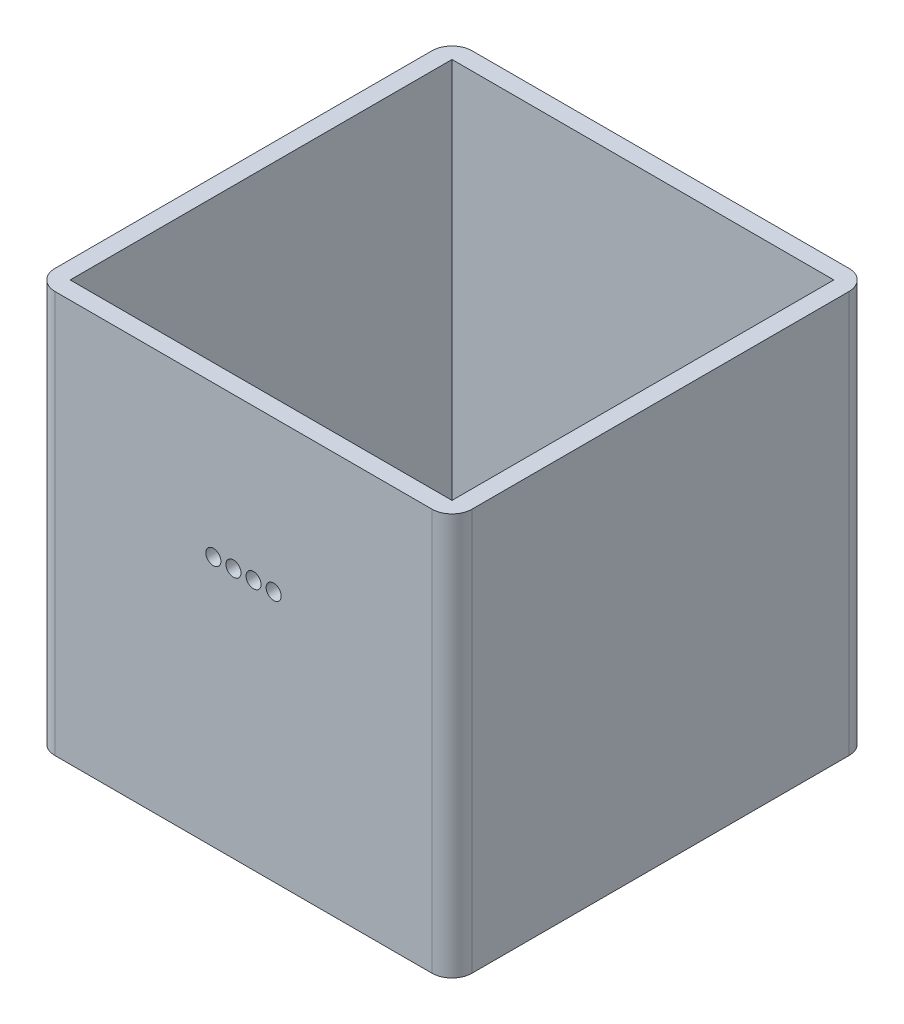
from build123d import *

# Parameters (mm, degrees)
BOSS_EXTRUDE2_DEPTH      = 40
BOSS_EXTRUDE2_DEPTH_BACK = 40
SKETCH4_W                = 83
SKETCH4_H                = 83
CUT_EXTRUDE1_DEPTH       = 50
CUT_EXTRUDE1_DEPTH_BACK  = 37.5
SKETCH5_W                = 76
SKETCH5_H                = 76
CUT_EXTRUDE2_DEPTH       = 74.5
CUT_EXTRUDE2_DEPTH_BACK  = 5
SKETCH6_R                = 1.5
SKETCH8_R                = 1
CUT_EXTRUDE3_DEPTH       = 70.5
SKETCH9_W                = 12
SKETCH9_H                = 7
CUT_EXTRUDE4_DEPTH       = 108.5
FILLET2_R                = 1
FILLET3_R                = 4


with BuildPart() as part:
    # Sketch4 → Boss-Extrude2 (new, two sides: drawn at the far end of the back side and taken through both)
    with BuildSketch(Plane(origin=(0, 0, 0), x_dir=(1, 0, 0), z_dir=(0, 1, 0)).offset(-BOSS_EXTRUDE2_DEPTH_BACK)):
        Rectangle(SKETCH4_W, SKETCH4_H)
    extrude(amount=BOSS_EXTRUDE2_DEPTH + BOSS_EXTRUDE2_DEPTH_BACK)

    # Sketch5 → Cut-Extrude1 (cut, two sides: drawn at the far end of the back side and taken through both)
    with BuildSketch(Plane(origin=(0, 0, 0), x_dir=(1, 0, 0), z_dir=(0, 1, 0)).offset(-CUT_EXTRUDE1_DEPTH_BACK)):
        Rectangle(SKETCH5_W, SKETCH5_H)
    extrude(amount=CUT_EXTRUDE1_DEPTH + CUT_EXTRUDE1_DEPTH_BACK, mode=Mode.SUBTRACT)

    # Sketch6 → Cut-Extrude2 (cut, two sides: drawn at the far end of the back side and taken through both)
    with BuildSketch(Plane.XY.offset(-CUT_EXTRUDE2_DEPTH_BACK)):
        with Locations((2, 10)):
            Circle(SKETCH6_R)
        with Locations((6, 10)):
            Circle(SKETCH6_R)
        with Locations((-2, 10)):
            Circle(SKETCH6_R)
        with Locations((-6, 10)):
            Circle(SKETCH6_R)
    extrude(amount=CUT_EXTRUDE2_DEPTH + CUT_EXTRUDE2_DEPTH_BACK, mode=Mode.SUBTRACT)

    # Sketch8 → Cut-Extrude3 (cut)
    with BuildSketch(Plane.XY):
        with Locations((0, -9)):
            Circle(SKETCH8_R)
        with Locations((2.5, -9)):
            Circle(SKETCH8_R)
        with Locations((0, -6.5)):
            Circle(SKETCH8_R)
        with Locations((-2.5, -9)):
            Circle(SKETCH8_R)
        with Locations((0, -11.5)):
            Circle(SKETCH8_R)
    extrude(amount=-CUT_EXTRUDE3_DEPTH, mode=Mode.SUBTRACT)

    # Sketch9 → Cut-Extrude4 (cut)
    with BuildSketch(Plane.XY):
        with Locations((24, -18.5)):
            Rectangle(SKETCH9_W, SKETCH9_H)
    extrude(amount=-CUT_EXTRUDE4_DEPTH, mode=Mode.SUBTRACT)

    # Fillet2
    fillet2_edges = [part.edges().sort_by_distance(p)[0] for p in [
        (18, -22, -39.75),
        (30, -22, -39.75),
        (18, -15, -39.75),
        (30, -15, -39.75),
    ]]
    fillet(fillet2_edges, radius=FILLET2_R)

    # Fillet3
    fillet3_edges = [part.edges().sort_by_distance(p)[0] for p in [
        (-41.5, 0, 41.5),
        (41.5, 0, -41.5),
        (41.5, 0, 41.5),
        (-41.5, 0, -41.5),
    ]]
    fillet(fillet3_edges, radius=FILLET3_R)


solid = part.part
